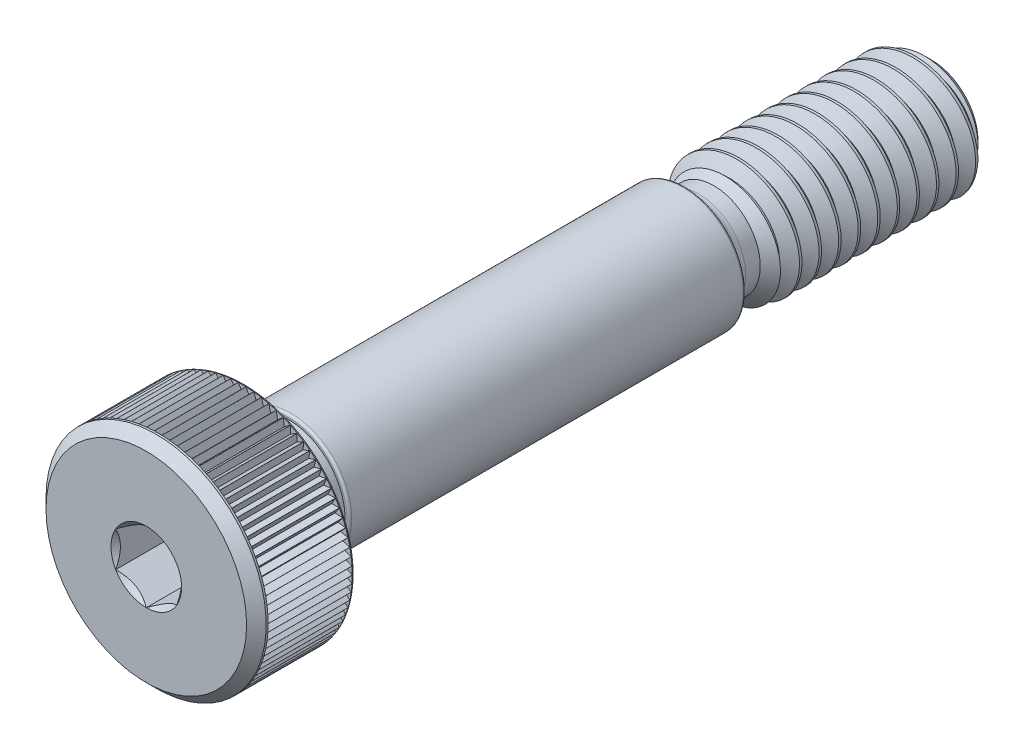
from build123d import *

# Parameters (mm, degrees)
CUT_EXTRUDE2_DEPTH = 2
CUT_SWEEP1_PITCH   = 0.8
CUT_EXTRUDE5_DEPTH = 3.44
CIRPATTERN1_COUNT  = 90


with BuildPart() as part:
    # Sketch12 → Revolve1 (revolve)
    with BuildSketch(Plane(origin=(0, 0, 0), x_dir=(0, 0, -1), z_dir=(1, 0, 0)), mode=Mode.PRIVATE) as revolve1_sk:
        with BuildLine():
            Line((-16.05, 0), (-16.05, 4.1))
            Line((-16.05, 4.1), (-15.65, 4.5))
            Line((-15.65, 4.5), (-12.13, 4.5))
            ThreePointArc((-12.13, 4.5), (-12.073431458, 4.476568542), (-12.05, 4.42))
            Line((-12.05, 4.42), (-12.05, 2.325))
            Line((-12.05, 2.325), (-10.25, 2.325))
            Line((-10.25, 2.325), (-10.25, 2.4))
            ThreePointArc((-10.25, 2.4), (-10.220710678, 2.470710678), (-10.15, 2.5))
            Line((-10.15, 2.5), (5.857179677, 2.5))
            ThreePointArc((5.857179677, 2.5), (5.922645044, 2.475592895), (5.956154009, 2.414285714))
            ThreePointArc((5.956154009, 2.414285714), (6.157207798, 2.046442632), (6.55, 1.9))
            Line((6.55, 1.9), (7.15, 1.9))
            Line((7.15, 1.9), (7.75, 2.5))
            Line((7.75, 2.5), (15.45, 2.5))
            Line((15.45, 2.5), (16.05, 1.9))
            Line((16.05, 1.9), (16.05, 0))
            Line((16.05, 0), (-16.05, 0))
        make_face()
    revolve(revolve1_sk.sketch.rotate(Axis((0, 0, -16.05), (0, 0, 1)), 90), axis=Axis((0, 0, -16.05), (0, 0, 1)))

    # Sketch8 → Cut-Extrude2 (cut)
    with BuildSketch(Plane.XY.offset(16.05)):
        Polygon((0, -1.443375673), (1.25, -0.721687836), (1.25, 0.721687836), (0, 1.443375673), (-1.25, 0.721687836), (-1.25, -0.721687836), align=None)
    extrude(amount=-CUT_EXTRUDE2_DEPTH, mode=Mode.SUBTRACT)

    # Cut-Extrude4 cone 1 section (through the dimple's axis) → Cut-Extrude4 (revolve, cut)
    with BuildSketch(Plane(origin=(0, 0, 16.05), x_dir=(0, -1, 0), z_dir=(1, 0, 0))):
        Polygon((0, 0), (1.443375673, 0), (0, 1.443375673), align=None)
    revolve(axis=Axis((0, 0, 16.05), (0, 0, -1)), mode=Mode.SUBTRACT)


with BuildPart() as body_2:
    # Split1: the piece on the far side of the plane
    add(part.part)
    split(bisect_by=Plane(origin=(0, 0, -7.15), x_dir=(0, -1, 0), z_dir=(0, 0, -1)), keep=Keep.BOTTOM)


with BuildPart() as part_1:
    add(part.part)

    # Split1
    split(bisect_by=Plane(origin=(0, 0, -7.15), x_dir=(0, -1, 0), z_dir=(0, 0, -1)), keep=Keep.TOP)

    # Cut-Sweep1: the profile of Sketch13 screwed along a right-hand helix of 11.875 turns, 8 arcs to a turn; built about Z, then put on its axis
    cut_sweep1_z = Axis((0, 0, 0), (0, 0, 1))
    cut_sweep1_corners = [(2.54330127, 0, 0.025), (2.54330127, 0, -0.725), (1.980384758, 0, -0.4), (1.980384758, 0, -0.3)]
    with BuildLine(mode=Mode.PRIVATE) as cut_sweep1_profile:
        Line(cut_sweep1_corners[0], cut_sweep1_corners[1])
        Line(cut_sweep1_corners[1], cut_sweep1_corners[2])
        Line(cut_sweep1_corners[2], cut_sweep1_corners[3])
        Line(cut_sweep1_corners[3], cut_sweep1_corners[0])
    cut_sweep1_cap = Face(cut_sweep1_profile.wire())
    cut_sweep1_turn_angles = [0, 22.5, 45, 67.5, 90, 112.5, 135, 157.5, 180, 202.5, 225, 247.5, 270, 292.5, 315, 337.5, 360]
    cut_sweep1_turn_weights = [1, 0.9238795325112867, 1, 0.9238795325112867, 1, 0.9238795325112867, 1, 0.9238795325112867, 1, 0.9238795325112867, 1, 0.9238795325112867, 1, 0.9238795325112867, 1, 0.9238795325112867, 1]
    cut_sweep1_turn_rails = [Edge.make_bspline([Vector(p[0], p[1], 0).rotate(cut_sweep1_z, cut_sweep1_turn_angles[k]) / cut_sweep1_turn_weights[k] + Vector(0, 0, p[2] + CUT_SWEEP1_PITCH * cut_sweep1_turn_angles[k] / 360) for k in range(17)], [0, 0, 0, 1, 1, 2, 2, 3, 3, 4, 4, 5, 5, 6, 6, 7, 7, 8, 8, 8], 2, cut_sweep1_turn_weights) for p in cut_sweep1_corners]
    cut_sweep1_turn_sides = [Face.make_surface_from_curves(cut_sweep1_turn_rails[p[0]], cut_sweep1_turn_rails[p[1]]) for p in [(0, 1), (1, 2), (2, 3), (3, 0)]]
    cut_sweep1_last_angles = [3960, 3982.5, 4005, 4027.5, 4050, 4072.5, 4095, 4117.5, 4140, 4162.5, 4185, 4207.5, 4230, 4252.5, 4275]
    cut_sweep1_last_weights = [1, 0.9238795325112867, 1, 0.9238795325112867, 1, 0.9238795325112867, 1, 0.9238795325112867, 1, 0.9238795325112867, 1, 0.9238795325112867, 1, 0.923879532511229, 1]
    cut_sweep1_last_rails = [Edge.make_bspline([Vector(p[0], p[1], 0).rotate(cut_sweep1_z, cut_sweep1_last_angles[k]) / cut_sweep1_last_weights[k] + Vector(0, 0, p[2] + CUT_SWEEP1_PITCH * cut_sweep1_last_angles[k] / 360) for k in range(15)], [0, 0, 0, 1, 1, 2, 2, 3, 3, 4, 4, 5, 5, 6, 6, 7, 7, 7], 2, cut_sweep1_last_weights) for p in cut_sweep1_corners]
    cut_sweep1_last_sides = [Face.make_surface_from_curves(cut_sweep1_last_rails[p[0]], cut_sweep1_last_rails[p[1]]) for p in [(0, 1), (1, 2), (2, 3), (3, 0)]]
    cut_sweep1 = Plane(origin=(0, 0, -16.05), x_dir=(0, 1, 0), z_dir=(0, 0, 1)) * Solid(Shell([*[p.moved(Location((0, 0, CUT_SWEEP1_PITCH * i))) for i in range(11) for p in cut_sweep1_turn_sides], *cut_sweep1_last_sides, cut_sweep1_cap, cut_sweep1_cap.rotate(cut_sweep1_z, 4275).moved(Location((0, 0, CUT_SWEEP1_PITCH * 4275 / 360)))]))
    add(cut_sweep1, mode=Mode.SUBTRACT)


with BuildPart() as body_2_1:
    add(body_2.part)

    # Combine1: union part
    add(part_1.part)

    # Sketch11 → Cut-Extrude5 (cut)
    with BuildSketch(Plane.XY.offset(15.57)):
        Polygon((0.157143463, 4.5), (0, 4.227819539), (-0.157143463, 4.5), align=None)
    cut_extrude5 = extrude(amount=-CUT_EXTRUDE5_DEPTH, mode=Mode.SUBTRACT)

    # CirPattern1: Cut-Extrude5 ×90 about axis
    cirpattern1_axis = Axis((0, 0, 0), (0, 0, 1))
    for i in range(1, CIRPATTERN1_COUNT):
        add(cut_extrude5.rotate(cirpattern1_axis, i * 360 / CIRPATTERN1_COUNT), mode=Mode.SUBTRACT)


solid = body_2_1.part
